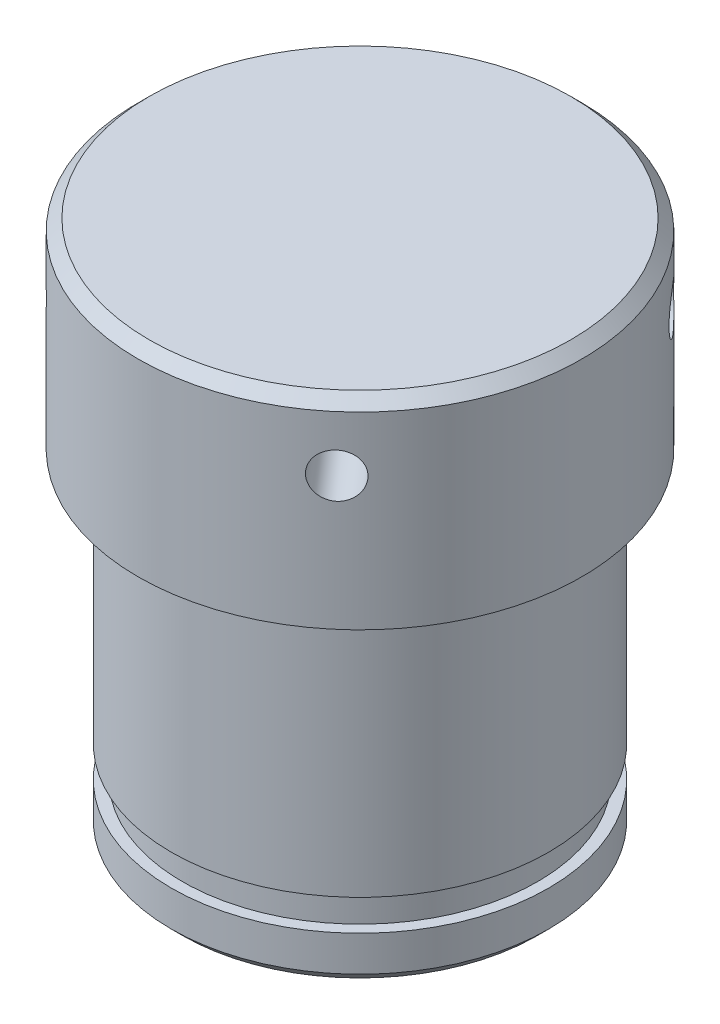
from build123d import *

# Parameters (mm, degrees)
SKETCH_1_R               = 8.5
EXTRUDE_1_DEPTH          = 15
SKETCH_2_R               = 10
EXTRUDE_2_DEPTH          = 9
SKETCH_3_R               = 1
CUT_EXTRUDE_1_DEPTH      = 10
CUT_EXTRUDE_START        = -2.1
SKETCH_4_R               = 8.5
SKETCH_4_R_2             = 8
CUT_EXTRUDE_2_DEPTH      = 1.4
CHAMFER_1_SIZE           = 0.5
SKETCH_7_R               = 1
CUT_EXTRUDE_3_DEPTH      = 8
PATTERN_CIRCULAR_1_COUNT = 4


with BuildPart() as part:
    # Эскиз1 → Бобышка-Вытянуть1 (new body)
    with BuildSketch(Plane(origin=(0, 0, 0), x_dir=(1, 0, 0), z_dir=(0, 1, 0))):
        Circle(SKETCH_1_R)
    extrude(amount=EXTRUDE_1_DEPTH)

    # Эскиз2 → Бобышка-Вытянуть2 (add)
    with BuildSketch(Plane(origin=(0, 15, 0), x_dir=(1, 0, 0), z_dir=(0, 1, 0))):
        Circle(SKETCH_2_R)
    extrude(amount=EXTRUDE_2_DEPTH)

    # Эскиз3 → Вырез-Вытянуть1 (cut)
    with BuildSketch(Plane.XZ):
        with Locations((0, 6)):
            Circle(SKETCH_3_R)
        with Locations((6, 0)):
            Circle(SKETCH_3_R)
        with Locations((0, -6)):
            Circle(SKETCH_3_R)
        with Locations((-6, 0)):
            Circle(SKETCH_3_R)
    extrude(amount=-CUT_EXTRUDE_1_DEPTH, mode=Mode.SUBTRACT)

    # Эскиз4 → Вырез-Вытянуть2 (cut)
    with BuildSketch(Plane.XZ.offset(CUT_EXTRUDE_START)):
        Circle(SKETCH_4_R)
        Circle(SKETCH_4_R_2, mode=Mode.SUBTRACT)
    extrude(amount=-CUT_EXTRUDE_2_DEPTH, mode=Mode.SUBTRACT)

    # Фаска1
    chamfer_1_edges = [part.edges().sort_by_distance(p)[0] for p in [
        (-8.5, 0, 0),
        (-10, 24, 0),
    ]]
    chamfer(chamfer_1_edges, length=CHAMFER_1_SIZE)

    # Эскиз7 → Вырез-Вытянуть3 (cut)
    with BuildSketch(Plane(origin=(6.524591557, 0, 7.578238913), x_dir=(0.7578238912515232, 0, -0.6524591556935956), z_dir=(0.6524591556935956, 0, 0.7578238912515232))):
        with Locations((0, 21)):
            Circle(SKETCH_7_R)
    cut_extrude_3 = extrude(amount=-CUT_EXTRUDE_3_DEPTH, mode=Mode.SUBTRACT)

    # Круговой массив1: Вырез-Вытянуть3 ×4 about axis
    pattern_circular_1_axis = Axis((0, 24, 0), (0, -1, 0))
    for i in range(1, PATTERN_CIRCULAR_1_COUNT):
        add(cut_extrude_3.rotate(pattern_circular_1_axis, i * 360 / PATTERN_CIRCULAR_1_COUNT), mode=Mode.SUBTRACT)


solid = part.part
